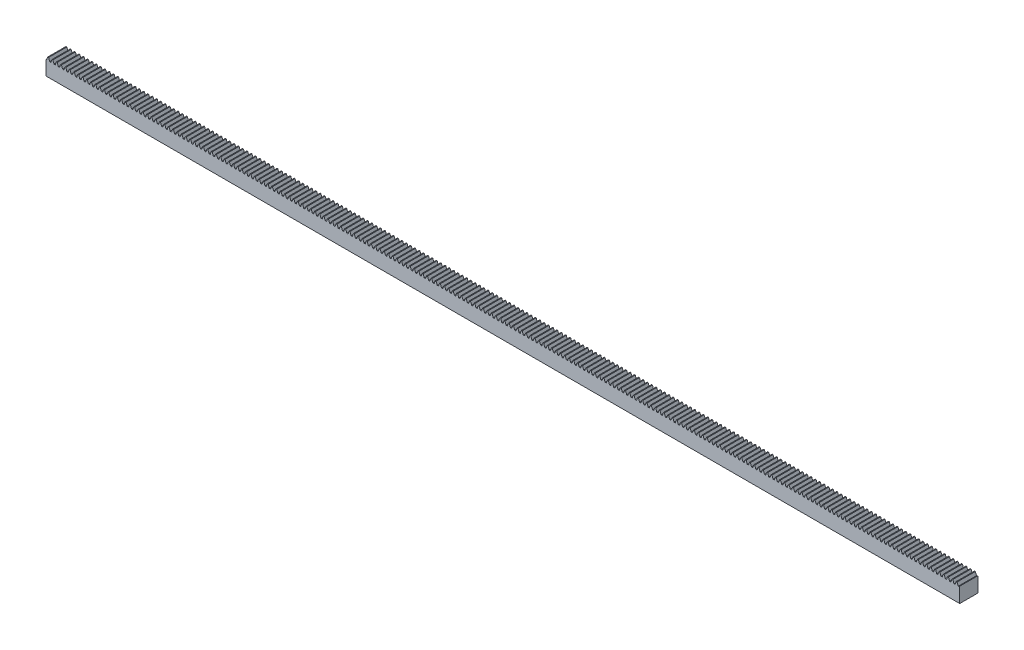
from build123d import *

# Parameters (mm, degrees)
BLANKSKE_W        = 400
BLANKSKE_H        = 7.6
BLANK_DEPTH       = 8
TOOTHCUTSIM_DEPTH = 401.152171055
TEETHCUTS_COUNT   = 214
TEETHCUTS_PITCH   = 1.88495559


with BuildPart() as part:
    # BlankSke → Blank (new body)
    with BuildSketch(Plane.XY):
        with Locations((200, 3.8)):
            Rectangle(BLANKSKE_W, BLANKSKE_H)
    extrude(amount=-BLANK_DEPTH)

    # TooCutSkeSim → ToothCutSim (cut, through all)
    with BuildSketch(Plane.XY):
        Polygon((0.267261222, 6.25), (-0.267261222, 6.25), (-0.767865882, 7.6254), (0.767865882, 7.6254), align=None)
    toothcutsim = extrude(amount=-TOOTHCUTSIM_DEPTH, mode=Mode.SUBTRACT)

    # TeethCuts: ToothCutSim ×214
    with Locations(*[(i * TEETHCUTS_PITCH, 0, 0) for i in range(1, TEETHCUTS_COUNT)]):
        add(toothcutsim, mode=Mode.SUBTRACT)


solid = part.part
